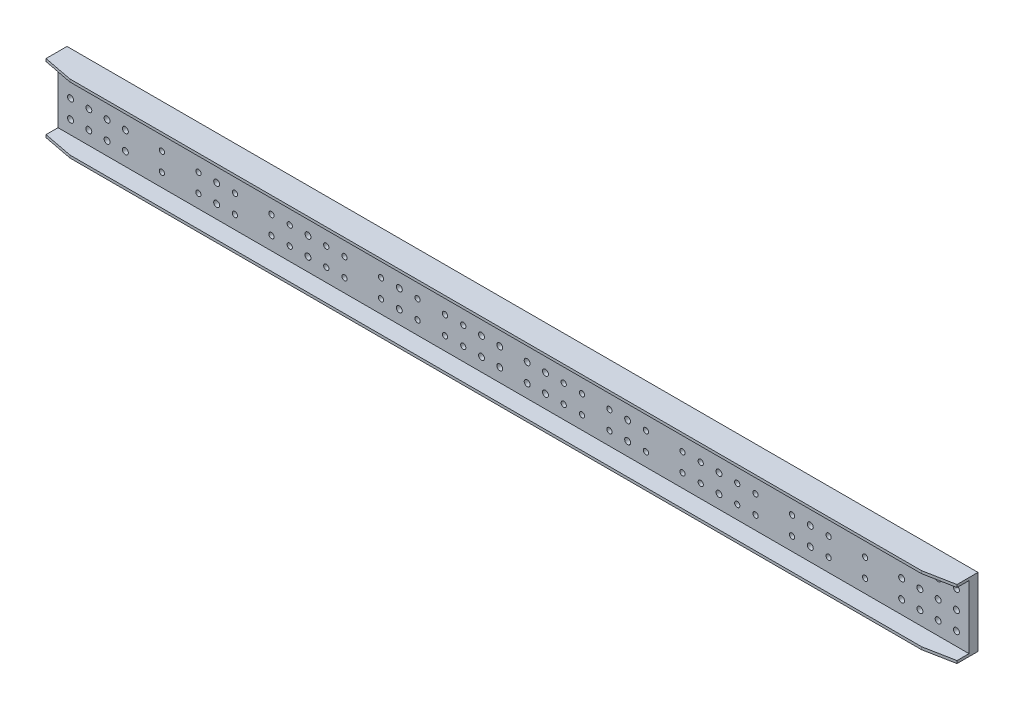
from build123d import *

# Parameters (mm, degrees)
SKETCH_1_W          = 3990
SKETCH_1_H          = 300
SKETCH_1_R          = 13
SKETCH_1_R_2        = 11.5
EXTRUDE_1538_DEPTH  = 39.5
SKETCH_2_W          = 3990
SKETCH_2_H          = 11.5
EXTRUDE_1_DEPTH     = 77.5
SKETCH_3_W          = 70
SKETCH_3_H          = 230
EXTRUDE_2_DEPTH     = 16
SKETCH_4_R          = 13
CUT_EXTRUDE_1_DEPTH = 2003.131676489
CUT_EXTRUDE_2_DEPTH = 2021.820130541


with BuildPart() as part:
    # 草图1 → Extrude 1538 (new body)
    with BuildSketch(Plane.XY):
        Rectangle(SKETCH_1_W, SKETCH_1_H)
        with Locations((1940, 80)):
            Circle(SKETCH_1_R, mode=Mode.SUBTRACT)
        with Locations((1860, 80)):
            Circle(SKETCH_1_R, mode=Mode.SUBTRACT)
        with Locations((1780, 80)):
            Circle(SKETCH_1_R, mode=Mode.SUBTRACT)
        with Locations((1700, 80)):
            Circle(SKETCH_1_R, mode=Mode.SUBTRACT)
        with Locations((1540, 80)):
            Circle(SKETCH_1_R_2, mode=Mode.SUBTRACT)
        with Locations((1380, 80)):
            Circle(SKETCH_1_R_2, mode=Mode.SUBTRACT)
        with Locations((1220, 80)):
            Circle(SKETCH_1_R_2, mode=Mode.SUBTRACT)
        with Locations((1060, 80)):
            Circle(SKETCH_1_R_2, mode=Mode.SUBTRACT)
        with Locations((980, 80)):
            Circle(SKETCH_1_R_2, mode=Mode.SUBTRACT)
        with Locations((820, 80)):
            Circle(SKETCH_1_R_2, mode=Mode.SUBTRACT)
        with Locations((740, 80)):
            Circle(SKETCH_1_R_2, mode=Mode.SUBTRACT)
        with Locations((580, 80)):
            Circle(SKETCH_1_R_2, mode=Mode.SUBTRACT)
        with Locations((980, 0)):
            Circle(SKETCH_1_R_2, mode=Mode.SUBTRACT)
        with Locations((1060, 0)):
            Circle(SKETCH_1_R_2, mode=Mode.SUBTRACT)
        with Locations((820, 0)):
            Circle(SKETCH_1_R_2, mode=Mode.SUBTRACT)
        with Locations((740, 0)):
            Circle(SKETCH_1_R_2, mode=Mode.SUBTRACT)
        with Locations((580, 0)):
            Circle(SKETCH_1_R_2, mode=Mode.SUBTRACT)
        with Locations((1220, 0)):
            Circle(SKETCH_1_R_2, mode=Mode.SUBTRACT)
        with Locations((1380, 0)):
            Circle(SKETCH_1_R_2, mode=Mode.SUBTRACT)
        with Locations((1540, 0)):
            Circle(SKETCH_1_R_2, mode=Mode.SUBTRACT)
        with Locations((1700, 0)):
            Circle(SKETCH_1_R, mode=Mode.SUBTRACT)
        with Locations((1780, 0)):
            Circle(SKETCH_1_R, mode=Mode.SUBTRACT)
        with Locations((1860, 0)):
            Circle(SKETCH_1_R, mode=Mode.SUBTRACT)
        with Locations((1940, 0)):
            Circle(SKETCH_1_R, mode=Mode.SUBTRACT)
        with Locations((420, 80)):
            Circle(SKETCH_1_R_2, mode=Mode.SUBTRACT)
        with Locations((420, 0)):
            Circle(SKETCH_1_R_2, mode=Mode.SUBTRACT)
        with Locations((300, 0)):
            Circle(SKETCH_1_R_2, mode=Mode.SUBTRACT)
        with Locations((300, 80)):
            Circle(SKETCH_1_R_2, mode=Mode.SUBTRACT)
        with Locations((220, 80)):
            Circle(SKETCH_1_R_2, mode=Mode.SUBTRACT)
        with Locations((220, 0)):
            Circle(SKETCH_1_R_2, mode=Mode.SUBTRACT)
        with Locations((140, 0)):
            Circle(SKETCH_1_R, mode=Mode.SUBTRACT)
        with Locations((140, 80)):
            Circle(SKETCH_1_R, mode=Mode.SUBTRACT)
        with Locations((60, 80)):
            Circle(SKETCH_1_R, mode=Mode.SUBTRACT)
        with Locations((60, 0)):
            Circle(SKETCH_1_R, mode=Mode.SUBTRACT)
        with Locations((1700, -80)):
            Circle(SKETCH_1_R, mode=Mode.SUBTRACT)
        with Locations((1780, -80)):
            Circle(SKETCH_1_R, mode=Mode.SUBTRACT)
        with Locations((1860, -80)):
            Circle(SKETCH_1_R, mode=Mode.SUBTRACT)
        with Locations((1940, -80)):
            Circle(SKETCH_1_R, mode=Mode.SUBTRACT)
        with Locations((580, -80)):
            Circle(SKETCH_1_R_2, mode=Mode.SUBTRACT)
        with Locations((740, -80)):
            Circle(SKETCH_1_R_2, mode=Mode.SUBTRACT)
        with Locations((820, -80)):
            Circle(SKETCH_1_R_2, mode=Mode.SUBTRACT)
        with Locations((980, -80)):
            Circle(SKETCH_1_R_2, mode=Mode.SUBTRACT)
        with Locations((1060, -80)):
            Circle(SKETCH_1_R_2, mode=Mode.SUBTRACT)
        with Locations((1220, -80)):
            Circle(SKETCH_1_R_2, mode=Mode.SUBTRACT)
        with Locations((1380, -80)):
            Circle(SKETCH_1_R_2, mode=Mode.SUBTRACT)
        with Locations((1540, -80)):
            Circle(SKETCH_1_R_2, mode=Mode.SUBTRACT)
        with Locations((220, -80)):
            Circle(SKETCH_1_R_2, mode=Mode.SUBTRACT)
        with Locations((300, -80)):
            Circle(SKETCH_1_R_2, mode=Mode.SUBTRACT)
        with Locations((420, -80)):
            Circle(SKETCH_1_R_2, mode=Mode.SUBTRACT)
        with Locations((60, -80)):
            Circle(SKETCH_1_R, mode=Mode.SUBTRACT)
        with Locations((140, -80)):
            Circle(SKETCH_1_R, mode=Mode.SUBTRACT)
        with Locations((-140, -80)):
            Circle(SKETCH_1_R, mode=Mode.SUBTRACT)
        with Locations((-60, -80)):
            Circle(SKETCH_1_R, mode=Mode.SUBTRACT)
        with Locations((-580, -80)):
            Circle(SKETCH_1_R_2, mode=Mode.SUBTRACT)
        with Locations((-420, -80)):
            Circle(SKETCH_1_R_2, mode=Mode.SUBTRACT)
        with Locations((-300, -80)):
            Circle(SKETCH_1_R_2, mode=Mode.SUBTRACT)
        with Locations((-220, -80)):
            Circle(SKETCH_1_R_2, mode=Mode.SUBTRACT)
        with Locations((-1540, -80)):
            Circle(SKETCH_1_R_2, mode=Mode.SUBTRACT)
        with Locations((-1380, -80)):
            Circle(SKETCH_1_R_2, mode=Mode.SUBTRACT)
        with Locations((-1220, -80)):
            Circle(SKETCH_1_R_2, mode=Mode.SUBTRACT)
        with Locations((-1060, -80)):
            Circle(SKETCH_1_R_2, mode=Mode.SUBTRACT)
        with Locations((-980, -80)):
            Circle(SKETCH_1_R_2, mode=Mode.SUBTRACT)
        with Locations((-820, -80)):
            Circle(SKETCH_1_R_2, mode=Mode.SUBTRACT)
        with Locations((-740, -80)):
            Circle(SKETCH_1_R_2, mode=Mode.SUBTRACT)
        with Locations((-1940, -80)):
            Circle(SKETCH_1_R, mode=Mode.SUBTRACT)
        with Locations((-1860, -80)):
            Circle(SKETCH_1_R, mode=Mode.SUBTRACT)
        with Locations((-1780, -80)):
            Circle(SKETCH_1_R, mode=Mode.SUBTRACT)
        with Locations((-1700, -80)):
            Circle(SKETCH_1_R, mode=Mode.SUBTRACT)
        with Locations((-60, 0)):
            Circle(SKETCH_1_R, mode=Mode.SUBTRACT)
        with Locations((-60, 80)):
            Circle(SKETCH_1_R, mode=Mode.SUBTRACT)
        with Locations((-140, 80)):
            Circle(SKETCH_1_R, mode=Mode.SUBTRACT)
        with Locations((-140, 0)):
            Circle(SKETCH_1_R, mode=Mode.SUBTRACT)
        with Locations((-220, 0)):
            Circle(SKETCH_1_R_2, mode=Mode.SUBTRACT)
        with Locations((-220, 80)):
            Circle(SKETCH_1_R_2, mode=Mode.SUBTRACT)
        with Locations((-300, 80)):
            Circle(SKETCH_1_R_2, mode=Mode.SUBTRACT)
        with Locations((-300, 0)):
            Circle(SKETCH_1_R_2, mode=Mode.SUBTRACT)
        with Locations((-420, 0)):
            Circle(SKETCH_1_R_2, mode=Mode.SUBTRACT)
        with Locations((-420, 80)):
            Circle(SKETCH_1_R_2, mode=Mode.SUBTRACT)
        with Locations((-1940, 0)):
            Circle(SKETCH_1_R, mode=Mode.SUBTRACT)
        with Locations((-1860, 0)):
            Circle(SKETCH_1_R, mode=Mode.SUBTRACT)
        with Locations((-1780, 0)):
            Circle(SKETCH_1_R, mode=Mode.SUBTRACT)
        with Locations((-1700, 0)):
            Circle(SKETCH_1_R, mode=Mode.SUBTRACT)
        with Locations((-1540, 0)):
            Circle(SKETCH_1_R_2, mode=Mode.SUBTRACT)
        with Locations((-1380, 0)):
            Circle(SKETCH_1_R_2, mode=Mode.SUBTRACT)
        with Locations((-1220, 0)):
            Circle(SKETCH_1_R_2, mode=Mode.SUBTRACT)
        with Locations((-580, 0)):
            Circle(SKETCH_1_R_2, mode=Mode.SUBTRACT)
        with Locations((-740, 0)):
            Circle(SKETCH_1_R_2, mode=Mode.SUBTRACT)
        with Locations((-820, 0)):
            Circle(SKETCH_1_R_2, mode=Mode.SUBTRACT)
        with Locations((-1060, 0)):
            Circle(SKETCH_1_R_2, mode=Mode.SUBTRACT)
        with Locations((-980, 0)):
            Circle(SKETCH_1_R_2, mode=Mode.SUBTRACT)
        with Locations((-580, 80)):
            Circle(SKETCH_1_R_2, mode=Mode.SUBTRACT)
        with Locations((-740, 80)):
            Circle(SKETCH_1_R_2, mode=Mode.SUBTRACT)
        with Locations((-820, 80)):
            Circle(SKETCH_1_R_2, mode=Mode.SUBTRACT)
        with Locations((-980, 80)):
            Circle(SKETCH_1_R_2, mode=Mode.SUBTRACT)
        with Locations((-1060, 80)):
            Circle(SKETCH_1_R_2, mode=Mode.SUBTRACT)
        with Locations((-1220, 80)):
            Circle(SKETCH_1_R_2, mode=Mode.SUBTRACT)
        with Locations((-1380, 80)):
            Circle(SKETCH_1_R_2, mode=Mode.SUBTRACT)
        with Locations((-1540, 80)):
            Circle(SKETCH_1_R_2, mode=Mode.SUBTRACT)
        with Locations((-1700, 80)):
            Circle(SKETCH_1_R, mode=Mode.SUBTRACT)
        with Locations((-1780, 80)):
            Circle(SKETCH_1_R, mode=Mode.SUBTRACT)
        with Locations((-1860, 80)):
            Circle(SKETCH_1_R, mode=Mode.SUBTRACT)
        with Locations((-1940, 80)):
            Circle(SKETCH_1_R, mode=Mode.SUBTRACT)
    extrude(amount=EXTRUDE_1538_DEPTH)

    # 草图2 → 凸台-拉伸1 (add)
    with BuildSketch(Plane.XY.offset(39.5)):
        with Locations((0, 144.25)):
            Rectangle(SKETCH_2_W, SKETCH_2_H)
        with Locations((0, -144.25)):
            Rectangle(SKETCH_2_W, SKETCH_2_H)
    extrude(amount=EXTRUDE_1_DEPTH)

    # 草图3 → 凸台-拉伸2 (add)
    with BuildSketch(Plane(origin=(0, 0, 0), x_dir=(-1, 0, 0), z_dir=(0, 0, -1))):
        with Locations((1300, 0)):
            Rectangle(SKETCH_3_W, SKETCH_3_H)
        with Locations((900, 0)):
            Rectangle(SKETCH_3_W, SKETCH_3_H)
        with Locations((-1300, 0)):
            Rectangle(SKETCH_3_W, SKETCH_3_H)
        with Locations((500, 0)):
            Rectangle(SKETCH_3_W, SKETCH_3_H)
        with Locations((-900, 0)):
            Rectangle(SKETCH_3_W, SKETCH_3_H)
        with Locations((-500, 0)):
            Rectangle(SKETCH_3_W, SKETCH_3_H)
    extrude(amount=EXTRUDE_2_DEPTH)

    # 草图4 → 切除-拉伸1 (cut, through all)
    with BuildSketch(Plane.XY.offset(39.5)):
        with Locations((1300, 80)):
            Circle(SKETCH_4_R)
        with Locations((900, 80)):
            Circle(SKETCH_4_R)
        with Locations((900, 0)):
            Circle(SKETCH_4_R)
        with Locations((1300, 0)):
            Circle(SKETCH_4_R)
        with Locations((900, -80)):
            Circle(SKETCH_4_R)
        with Locations((1300, -80)):
            Circle(SKETCH_4_R)
        with Locations((500, 80)):
            Circle(SKETCH_4_R)
        with Locations((500, 0)):
            Circle(SKETCH_4_R)
        with Locations((500, -80)):
            Circle(SKETCH_4_R)
        with Locations((-500, -80)):
            Circle(SKETCH_4_R)
        with Locations((-500, 0)):
            Circle(SKETCH_4_R)
        with Locations((-500, 80)):
            Circle(SKETCH_4_R)
        with Locations((-1300, -80)):
            Circle(SKETCH_4_R)
        with Locations((-900, -80)):
            Circle(SKETCH_4_R)
        with Locations((-1300, 0)):
            Circle(SKETCH_4_R)
        with Locations((-900, 0)):
            Circle(SKETCH_4_R)
        with Locations((-900, 80)):
            Circle(SKETCH_4_R)
        with Locations((-1300, 80)):
            Circle(SKETCH_4_R)
    extrude(amount=-CUT_EXTRUDE_1_DEPTH, mode=Mode.SUBTRACT)

    # 草图5 → 切除-拉伸2 (cut, through all)
    with BuildSketch(Plane(origin=(0, 150, 0), x_dir=(-1, 0, 0), z_dir=(0, 1, 0))):
        Polygon((-1995, 92), (-1995, 117), (-1865, 117), align=None)
        Polygon((1865, 117), (1995, 92), (1995, 117), align=None)
    extrude(amount=-CUT_EXTRUDE_2_DEPTH, mode=Mode.SUBTRACT)


solid = part.part
